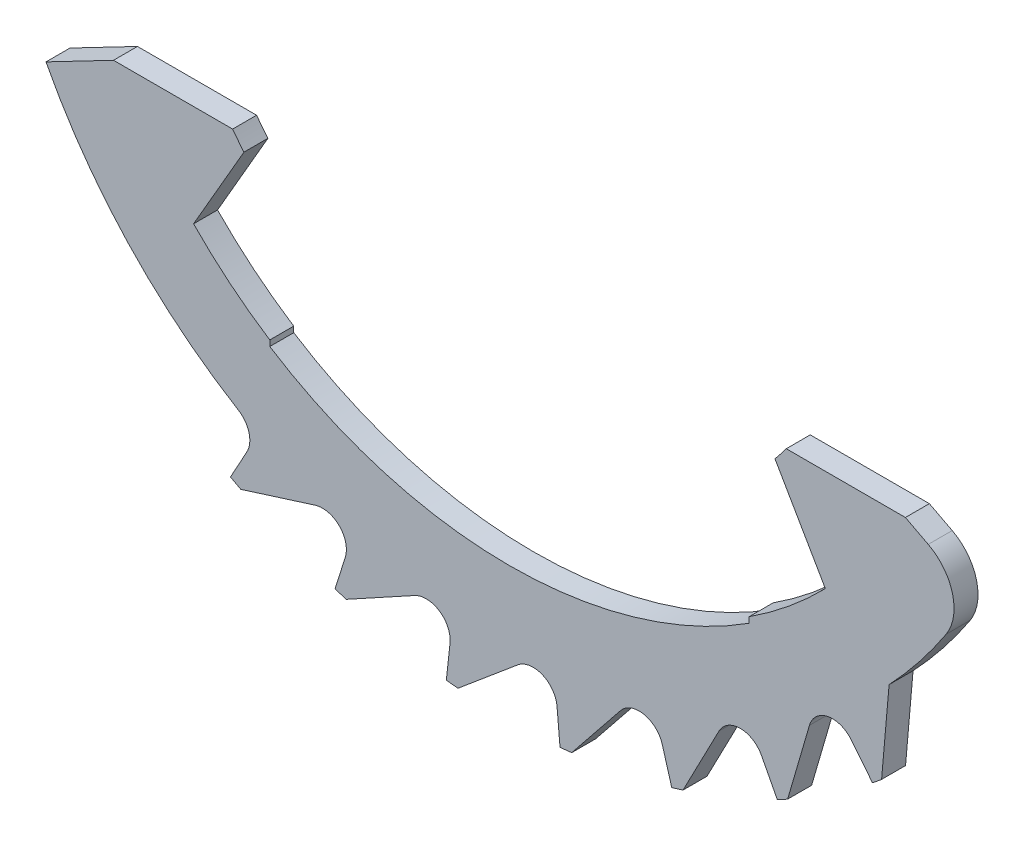
from build123d import *

# Parameters (mm, degrees)
OTHER_10076_5_DEPTH = 0.5
CUT_EXTRUDE1_START  = -0.5
CUT_EXTRUDE1_DEPTH  = 0.5


# Read off the part's stored shape, not the designer's step: 10076-5
with BuildPart() as part:
    # Other 10076-5 outline → Other 10076-5 (new body)
    with BuildSketch(Plane.XY):
        with BuildLine():
            ThreePointArc((7.573674013, -9.436602245), (7.668819519, -9.359444812), (7.763179028, -9.281328104))
            Line((7.763179028, -9.281328104), (7.919995926, -7.488902759))
            ThreePointArc((7.919995926, -7.488902759), (8.548470738, -6.76266575), (9.110578105, -5.983925684))
            ThreePointArc((9.110578105, -5.983925684), (9.242448569, -5.182849851), (8.736493865, -4.547930843))
            Line((8.736493865, -4.547930843), (8.260223146, -4.3))
            Line((8.260223146, -4.3), (5.774945887, -4.3))
            ThreePointArc((5.774945887, -4.3), (5.659072475, -4.451392897), (5.53923133, -4.5996648))
            Line((5.53923133, -4.5996648), (6.59, -6.419649523))
            ThreePointArc((6.59, -6.419649523), (5.831509763, -7.1157216), (5, -7.722693831))
            Line((5, -7.722693831), (5, -7.841555968))
            ThreePointArc((5, -7.841555968), (0, -9.3), (-5, -7.841555968))
            Line((-5, -7.841555968), (-5, -7.722693831))
            ThreePointArc((-5, -7.722693831), (-5.831509763, -7.1157216), (-6.59, -6.419649523))
            Line((-6.59, -6.419649523), (-5.53923133, -4.5996648))
            ThreePointArc((-5.53923133, -4.5996648), (-5.659072475, -4.451392897), (-5.774945887, -4.3))
            Line((-5.774945887, -4.3), (-8.260223146, -4.3))
            Line((-8.260223146, -4.3), (-10.732831081, -5.58715822))
            ThreePointArc((-10.732831081, -5.58715822), (-10.675718173, -5.6955282), (-10.617511084, -5.803314431))
            Line((-10.617511084, -5.803314431), (-9.055174855, -6.258693914))
            ThreePointArc((-9.055174855, -6.258693914), (-8.704696722, -6.64117368), (-8.882127626, -7.128661083))
            Line((-8.882127626, -7.128661083), (-9.436602245, -7.573674013))
            ThreePointArc((-9.436602245, -7.573674013), (-9.359444812, -7.668819519), (-9.281328104, -7.763179028))
            Line((-9.281328104, -7.763179028), (-7.660171598, -7.905011844))
            ThreePointArc((-7.660171598, -7.905011844), (-7.241809703, -8.211767477), (-7.320727248, -8.724502998))
            Line((-7.320727248, -8.724502998), (-7.777730077, -9.269137762))
            ThreePointArc((-7.777730077, -9.269137762), (-7.683493234, -9.347402405), (-7.588468891, -9.424709008))
            Line((-7.588468891, -9.424709008), (-5.970792243, -9.247544602))
            ThreePointArc((-5.970792243, -9.247544602), (-5.500623999, -9.466787654), (-5.477995427, -9.985067155))
            Line((-5.477995427, -9.985067155), (-5.819964104, -10.608393744))
            ThreePointArc((-5.819964104, -10.608393744), (-5.712269322, -10.666769858), (-5.603989074, -10.724052707))
            Line((-5.603989074, -10.724052707), (-4.05195869, -10.234699407))
            ThreePointArc((-4.05195869, -10.234699407), (-3.548052399, -10.358004491), (-3.424747314, -10.861910782))
            Line((-3.424747314, -10.861910782), (-3.638540174, -11.539975104))
            ThreePointArc((-3.638540174, -11.539975104), (-3.521526102, -11.576219327), (-3.404151099, -11.611277074))
            Line((-3.404151099, -11.611277074), (-1.977410637, -10.828540453))
            ThreePointArc((-1.977410637, -10.828540453), (-1.459131136, -10.851169025), (-1.239888083, -11.321337268))
            Line((-1.239888083, -11.321337268), (-1.317289186, -12.028081692))
            ThreePointArc((-1.317289186, -12.028081692), (-1.195452609, -12.04080118), (-1.073493507, -12.052286575))
            Line((-1.073493507, -12.052286575), (0.173128198, -11.006246762))
            ThreePointArc((0.173128198, -11.006246762), (0.685863719, -10.927329218), (0.992619352, -11.345691113))
            Line((0.992619352, -11.345691113), (1.054584487, -12.053955847))
            ThreePointArc((1.054584487, -12.053955847), (1.176561457, -12.042661796), (1.298417839, -12.030133462))
            Line((1.298417839, -12.030133462), (2.317013814, -10.760989181))
            ThreePointArc((2.317013814, -10.760989181), (2.804501216, -10.583558277), (3.186980982, -10.93403641))
            Line((3.186980982, -10.93403641), (3.38593107, -11.616603238))
            ThreePointArc((3.38593107, -11.616603238), (3.503360927, -11.581729673), (3.620431715, -11.545669067))
            Line((3.620431715, -11.545669067), (4.371857887, -10.10219282))
            ThreePointArc((4.371857887, -10.10219282), (4.815363304, -9.833067127), (5.258868721, -10.10219282))
            Line((5.258868721, -10.10219282), (5.58715822, -10.732831081))
            ThreePointArc((5.58715822, -10.732831081), (5.6955282, -10.675718173), (5.803314431, -10.617511084))
            Line((5.803314431, -10.617511084), (6.258693914, -9.055174855))
            ThreePointArc((6.258693914, -9.055174855), (6.64117368, -8.704696722), (7.128661083, -8.882127626))
            Line((7.128661083, -8.882127626), (7.573674013, -9.436602245))
        make_face()
    extrude(amount=OTHER_10076_5_DEPTH)

    # Sketch1 → Cut-Extrude1 (cut)
    with BuildSketch(Plane.XY.offset(0.5).offset(CUT_EXTRUDE1_START)):
        with BuildLine():
            Line((-9.668418082, -5.033059884), (-10.732831081, -5.58715822))
            ThreePointArc((-10.732831081, -5.58715822), (-9.359444812, -7.668819519), (-7.588468891, -9.424709008))
            Line((-7.588468891, -9.424709008), (-5.970792243, -9.247544602))
            ThreePointArc((-5.970792243, -9.247544602), (-5.808080301, -9.256437784), (-5.656869384, -9.317179228))
            ThreePointArc((-5.656869384, -9.317179228), (-7.956414306, -7.450199419), (-9.668418082, -5.033059884))
        make_face()
    extrude(amount=CUT_EXTRUDE1_DEPTH, mode=Mode.SUBTRACT)


solid = part.part
